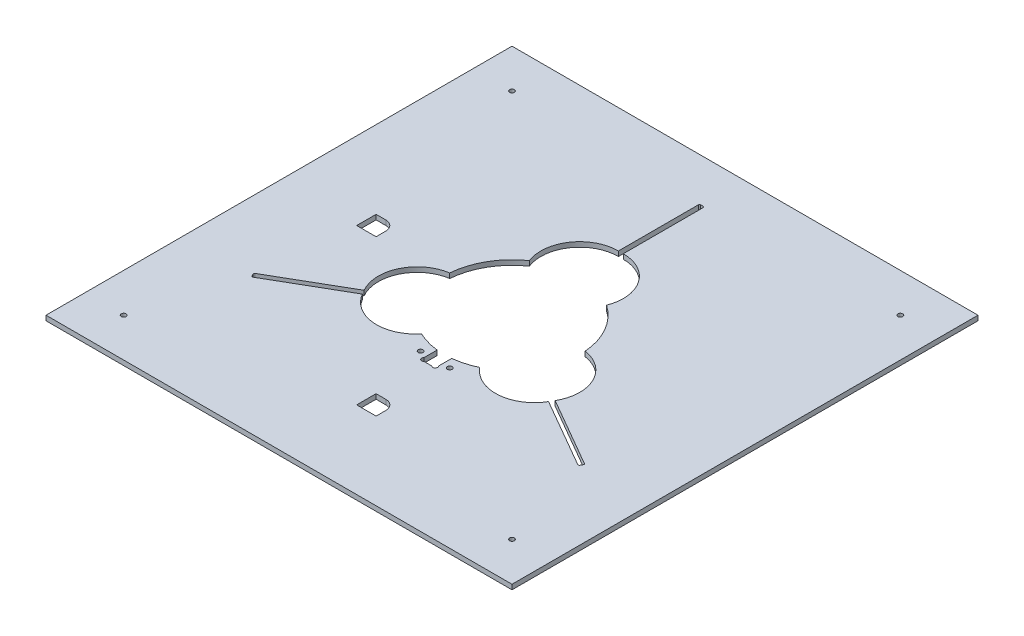
from build123d import *

# Parameters (mm, degrees)
SKETCH1_W           = 609.6
SKETCH1_H           = 609.6
BOSS_EXTRUDE1_DEPTH = 6.35
CUT_EXTRUDE2_DEPTH  = 432.099063441
SKETCH4_W           = 25.4
SKETCH4_H           = 25.4
CUT_EXTRUDE8_DEPTH  = 432.099063441
FILLET4_R           = 12.7
FILLET5_R           = 12.7
SKETCH5_R           = 3.175
CUT_EXTRUDE9_DEPTH  = 432.099063441
FILLET9_R           = 1.5875
SKETCH6_R           = 3.175
CUT_EXTRUDE10_DEPTH = 432.099063441


with BuildPart() as part:
    # Sketch1 → Boss-Extrude1 (new body)
    with BuildSketch(Plane(origin=(0, 0, 0), x_dir=(1, 0, 0), z_dir=(0, 1, 0))):
        Rectangle(SKETCH1_W, SKETCH1_H)
    extrude(amount=BOSS_EXTRUDE1_DEPTH)

    # Sketch3 → Cut-Extrude2 (cut, through all)
    with BuildSketch(Plane(origin=(0, 0, 0), x_dir=(1, 0, 0), z_dir=(0, 1, 0))):
        with BuildLine():
            Line((-3.175, 248.4755), (-3.175, 142.454689298))
            ThreePointArc((-3.175, 142.454689298), (-45.125573361, 120.304111538), (-50.492310608, 73.169232396))
            ThreePointArc((-50.492310608, 73.169232396), (-76.989658396, 44.45), (-88.612569335, 7.143007484))
            ThreePointArc((-88.612569335, 7.143007484), (-126.749203452, -21.072162878), (-124.95687982, -68.477713992))
            Line((-124.95687982, -68.477713992), (-216.773595218, -121.488119343))
            Line((-216.773595218, -121.488119343), (-213.598595218, -126.987380657))
            Line((-213.598595218, -126.987380657), (-121.78187982, -73.976975306))
            ThreePointArc((-121.78187982, -73.976975306), (-81.623630091, -99.23194866), (-38.120258727, -80.31223988))
            ThreePointArc((-38.120258727, -80.31223988), (0, -88.9), (38.120258727, -80.31223988))
            ThreePointArc((38.120258727, -80.31223988), (81.623630091, -99.23194866), (121.78187982, -73.976975306))
            Line((121.78187982, -73.976975306), (213.598595218, -126.987380657))
            Line((213.598595218, -126.987380657), (216.773595218, -121.488119343))
            Line((216.773595218, -121.488119343), (124.95687982, -68.477713992))
            ThreePointArc((124.95687982, -68.477713992), (126.749203452, -21.072162878), (88.612569335, 7.143007484))
            ThreePointArc((88.612569335, 7.143007484), (76.989658396, 44.45), (50.492310608, 73.169232396))
            ThreePointArc((50.492310608, 73.169232396), (45.125573361, 120.304111538), (3.175, 142.454689298))
            Line((3.175, 142.454689298), (3.175, 248.4755))
            Line((3.175, 248.4755), (-3.175, 248.4755))
        make_face()
    extrude(amount=CUT_EXTRUDE2_DEPTH, mode=Mode.SUBTRACT)

    # Sketch4 → Cut-Extrude8 (cut, through all)
    with BuildSketch(Plane(origin=(0, 0, 0), x_dir=(1, 0, 0), z_dir=(0, 1, 0))):
        with Locations((12.7, -190.5)):
            Rectangle(SKETCH4_W, SKETCH4_H)
        with Locations((-190.5, 12.7)):
            Rectangle(SKETCH4_W, SKETCH4_H)
    extrude(amount=CUT_EXTRUDE8_DEPTH, mode=Mode.SUBTRACT)

    # Fillet4
    fillet4_edges = [part.edges().sort_by_distance(p)[0] for p in [
        (-177.8, 3.175, -25.4),
    ]]
    fillet(fillet4_edges, radius=FILLET4_R)

    # Fillet5
    fillet5_edges = [part.edges().sort_by_distance(p)[0] for p in [
        (25.4, 3.175, 177.8),
    ]]
    fillet(fillet5_edges, radius=FILLET5_R)

    # Sketch5 → Cut-Extrude9 (cut, through all)
    with BuildSketch(Plane(origin=(0, 6.35, 0), x_dir=(1, 0, 0), z_dir=(0, 1, 0))):
        with Locations((-254, 254)):
            Circle(SKETCH5_R)
        with Locations((254, 254)):
            Circle(SKETCH5_R)
        with Locations((254, -254)):
            Circle(SKETCH5_R)
        with Locations((-254, -254)):
            Circle(SKETCH5_R)
    extrude(amount=-CUT_EXTRUDE9_DEPTH, mode=Mode.SUBTRACT)

    # Fillet9
    fillet9_edges = [part.edges().sort_by_distance(p)[0] for p in [
        (216.773595218, 3.175, 121.488119343),
        (213.598595218, 3.175, 126.987380657),
        (-216.773595218, 3.175, 121.488119343),
        (-213.598595218, 3.175, 126.987380657),
        (3.175, 3.175, -248.4755),
        (-3.175, 3.175, -248.4755),
    ]]
    fillet(fillet9_edges, radius=FILLET9_R)

    # Sketch6 → Cut-Extrude10 (cut, through all)
    with BuildSketch(Plane(origin=(0, 6.35, 0), x_dir=(1, 0, 0), z_dir=(0, 1, 0))):
        with Locations((19.05, -100.457)):
            Circle(SKETCH6_R)
        with Locations((-19.05, -100.457)):
            Circle(SKETCH6_R)
        with BuildLine():
            Line((-9.525, -100.457), (-9.525, -83.277048309))
            Line((-9.525, -83.277048309), (9.525, -83.277048309))
            Line((9.525, -83.277048309), (9.525, -100.457))
            Line((9.525, -100.457), (9.525, -105.491871939))
            ThreePointArc((9.525, -105.491871939), (9.525, -109.982), (5.034871939, -109.982))
            Line((5.034871939, -109.982), (-5.034871939, -109.982))
            ThreePointArc((-5.034871939, -109.982), (-9.525, -109.982), (-9.525, -105.491871939))
            Line((-9.525, -105.491871939), (-9.525, -100.457))
        make_face()
    extrude(amount=-CUT_EXTRUDE10_DEPTH, mode=Mode.SUBTRACT)


solid = part.part
